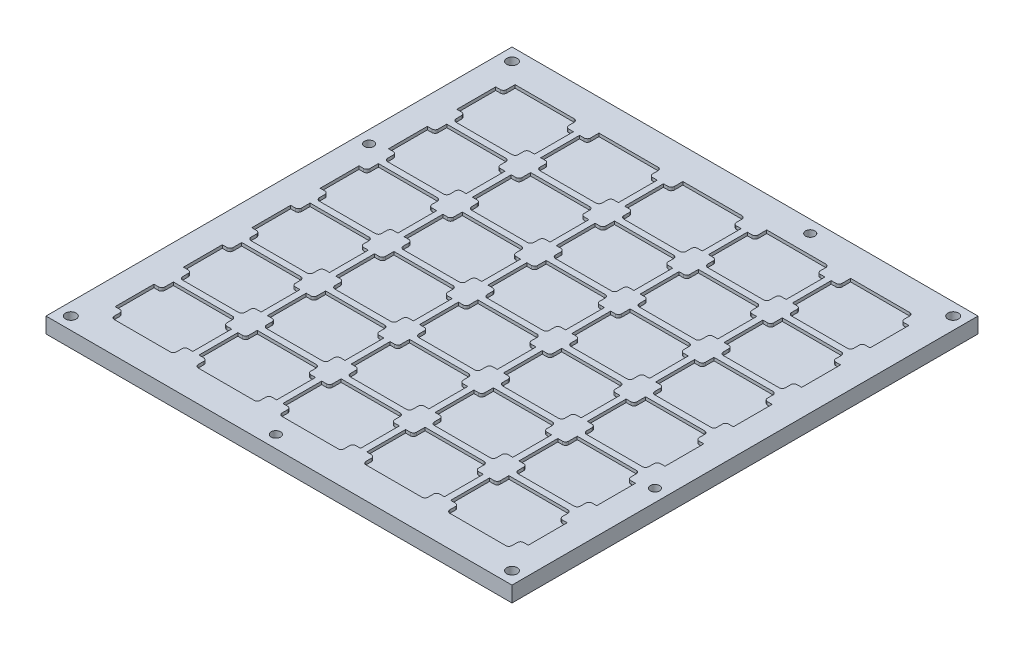
from build123d import *

# Parameters (mm, degrees)
SKETCH1_W                                       = 150
SKETCH1_H                                       = 150
BOSS_EXTRUDE1_DEPTH                             = 5
SKETCH2_W                                       = 20
SKETCH2_H                                       = 20
SKETCH2_W_2                                     = 2.5
SKETCH2_H_2                                     = 12.5
CUT_EXTRUDE1_DEPTH                              = 1
FILLET1_R                                       = 1
LPATTERN1_START                                 = 4
LPATTERN1_DEPTH                                 = 1
CSK_FOR_M3_FLAT_HEAD_MACHINE_SCREW1_D           = 3.4
CSK_FOR_M3_FLAT_HEAD_MACHINE_SCREW1_DEPTH       = 17.07
CSK_FOR_M3_FLAT_HEAD_MACHINE_SCREW1_CSINK_D     = 6.3
CSK_FOR_M3_FLAT_HEAD_MACHINE_SCREW1_CSINK_ANGLE = 90
CSK_FOR_M3_FLAT_HEAD_MACHINE_SCREW1_TIP         = 1.021463052
CSK_FOR_M3_FLAT_HEAD_MACHINE_SCREW2_D           = 3
CSK_FOR_M3_FLAT_HEAD_MACHINE_SCREW2_CSINK_D     = 6
CSK_FOR_M3_FLAT_HEAD_MACHINE_SCREW2_CSINK_ANGLE = 150


# Read off the part's stored shape, not the designer's step: LPattern1
with BuildPart() as part:
    # Sketch1 → Boss-Extrude1 (new body)
    with BuildSketch(Plane(origin=(0, 0, 0), x_dir=(1, 0, 0), z_dir=(0, 1, 0))):
        with Locations((73.607910906, -74.514208909)):
            Rectangle(SKETCH1_W, SKETCH1_H)
    extrude(amount=BOSS_EXTRUDE1_DEPTH)

    # Sketch2 → Cut-Extrude1 (cut)
    with BuildSketch(Plane(origin=(0, 5, 0), x_dir=(1, 0, 0), z_dir=(0, 1, 0))):
        with Locations((19.607910906, -19.514208909)):
            Rectangle(SKETCH2_W, SKETCH2_H)
        with Locations((8.357910906, -19.514208909)):
            Rectangle(SKETCH2_W_2, SKETCH2_H_2)
        with Locations((30.857910906, -19.514208909)):
            Rectangle(SKETCH2_W_2, SKETCH2_H_2)
    extrude(amount=-CUT_EXTRUDE1_DEPTH, mode=Mode.SUBTRACT)

    # Fillet1
    fillet1_edges = [part.edges().sort_by_distance(p)[0] for p in [
        (9.607910906, 4.5, 13.264208909),
        (9.607910906, 4.5, 25.764208909),
        (9.607910906, 4.5, 29.514208909),
        (29.607910906, 4.5, 29.514208909),
        (29.607910906, 4.5, 25.764208909),
        (29.607910906, 4.5, 13.264208909),
        (29.607910906, 4.5, 9.514208909),
    ]]
    fillet(fillet1_edges, radius=FILLET1_R)

    # LPattern1 outline → LPattern1 (cut)
    with BuildSketch(Plane(origin=(0, 0, 0), x_dir=(1, 0, 0), z_dir=(0, 1, 0)).offset(LPATTERN1_START)):
        with BuildLine():
            ThreePointArc((117.607910906, -122.264208909), (117.315017687, -122.971315691), (116.607910906, -123.264208909))
            Line((116.607910906, -123.264208909), (115.107910906, -123.264208909))
            Line((115.107910906, -123.264208909), (115.107910906, -135.764208909))
            Line((115.107910906, -135.764208909), (116.607910906, -135.764208909))
            ThreePointArc((116.607910906, -135.764208909), (117.315017687, -136.057102128), (117.607910906, -136.764208909))
            Line((117.607910906, -136.764208909), (117.607910906, -138.514208909))
            ThreePointArc((117.607910906, -138.514208909), (117.900804124, -139.221315691), (118.607910906, -139.514208909))
            Line((118.607910906, -139.514208909), (136.607910906, -139.514208909))
            ThreePointArc((136.607910906, -139.514208909), (137.315017687, -139.22131569), (137.607910906, -138.514208909))
            Line((137.607910906, -138.514208909), (137.607910906, -136.764208909))
            ThreePointArc((137.607910906, -136.764208909), (137.900804125, -136.057102128), (138.607910906, -135.764208909))
            Line((138.607910906, -135.764208909), (140.107910906, -135.764208909))
            Line((140.107910906, -135.764208909), (140.107910906, -123.264208909))
            Line((140.107910906, -123.264208909), (138.607910906, -123.264208909))
            ThreePointArc((138.607910906, -123.264208909), (137.900804125, -122.971315691), (137.607910906, -122.264208909))
            Line((137.607910906, -122.264208909), (137.607910906, -120.514208909))
            ThreePointArc((137.607910906, -120.514208909), (137.315017687, -119.807102128), (136.607910906, -119.514208909))
            Line((136.607910906, -119.514208909), (117.607910906, -119.514208909))
            Line((117.607910906, -119.514208909), (117.607910906, -122.264208909))
        make_face()
        with BuildLine():
            Line((137.607910906, -100.264208909), (137.607910906, -98.514208909))
            ThreePointArc((137.607910906, -98.514208909), (137.315017687, -97.807102128), (136.607910906, -97.514208909))
            Line((136.607910906, -97.514208909), (117.607910906, -97.514208909))
            Line((117.607910906, -97.514208909), (117.607910906, -100.264208909))
            ThreePointArc((117.607910906, -100.264208909), (117.315017687, -100.971315691), (116.607910906, -101.264208909))
            Line((116.607910906, -101.264208909), (115.107910906, -101.264208909))
            Line((115.107910906, -101.264208909), (115.107910906, -113.764208909))
            Line((115.107910906, -113.764208909), (116.607910906, -113.764208909))
            ThreePointArc((116.607910906, -113.764208909), (117.315017687, -114.057102128), (117.607910906, -114.764208909))
            Line((117.607910906, -114.764208909), (117.607910906, -116.514208909))
            ThreePointArc((117.607910906, -116.514208909), (117.900804124, -117.221315691), (118.607910906, -117.514208909))
            Line((118.607910906, -117.514208909), (136.607910906, -117.514208909))
            ThreePointArc((136.607910906, -117.514208909), (137.315017687, -117.221315691), (137.607910906, -116.514208909))
            Line((137.607910906, -116.514208909), (137.607910906, -114.764208909))
            ThreePointArc((137.607910906, -114.764208909), (137.900804125, -114.057102128), (138.607910906, -113.764208909))
            Line((138.607910906, -113.764208909), (140.107910906, -113.764208909))
            Line((140.107910906, -113.764208909), (140.107910906, -101.264208909))
            Line((140.107910906, -101.264208909), (138.607910906, -101.264208909))
            ThreePointArc((138.607910906, -101.264208909), (137.900804125, -100.971315691), (137.607910906, -100.264208909))
        make_face()
        with BuildLine():
            Line((137.607910906, -78.264208909), (137.607910906, -76.514208909))
            ThreePointArc((137.607910906, -76.514208909), (137.315017687, -75.807102128), (136.607910906, -75.514208909))
            Line((136.607910906, -75.514208909), (117.607910906, -75.514208909))
            Line((117.607910906, -75.514208909), (117.607910906, -78.264208909))
            ThreePointArc((117.607910906, -78.264208909), (117.315017687, -78.971315691), (116.607910906, -79.264208909))
            Line((116.607910906, -79.264208909), (115.107910906, -79.264208909))
            Line((115.107910906, -79.264208909), (115.107910906, -91.764208909))
            Line((115.107910906, -91.764208909), (116.607910906, -91.764208909))
            ThreePointArc((116.607910906, -91.764208909), (117.315017687, -92.057102128), (117.607910906, -92.764208909))
            Line((117.607910906, -92.764208909), (117.607910906, -94.514208909))
            ThreePointArc((117.607910906, -94.514208909), (117.900804124, -95.221315691), (118.607910906, -95.514208909))
            Line((118.607910906, -95.514208909), (136.607910906, -95.514208909))
            ThreePointArc((136.607910906, -95.514208909), (137.315017687, -95.221315691), (137.607910906, -94.514208909))
            Line((137.607910906, -94.514208909), (137.607910906, -92.764208909))
            ThreePointArc((137.607910906, -92.764208909), (137.900804125, -92.057102128), (138.607910906, -91.764208909))
            Line((138.607910906, -91.764208909), (140.107910906, -91.764208909))
            Line((140.107910906, -91.764208909), (140.107910906, -79.264208909))
            Line((140.107910906, -79.264208909), (138.607910906, -79.264208909))
            ThreePointArc((138.607910906, -79.264208909), (137.900804125, -78.971315691), (137.607910906, -78.264208909))
        make_face()
        with BuildLine():
            Line((137.607910906, -56.264208909), (137.607910906, -54.514208909))
            ThreePointArc((137.607910906, -54.514208909), (137.315017687, -53.807102128), (136.607910906, -53.514208909))
            Line((136.607910906, -53.514208909), (117.607910906, -53.514208909))
            Line((117.607910906, -53.514208909), (117.607910906, -56.264208909))
            ThreePointArc((117.607910906, -56.264208909), (117.315017688, -56.97131569), (116.607910906, -57.264208909))
            Line((116.607910906, -57.264208909), (115.107910906, -57.264208909))
            Line((115.107910906, -57.264208909), (115.107910906, -69.764208909))
            Line((115.107910906, -69.764208909), (116.607910906, -69.764208909))
            ThreePointArc((116.607910906, -69.764208909), (117.315017687, -70.057102128), (117.607910906, -70.764208909))
            Line((117.607910906, -70.764208909), (117.607910906, -72.514208909))
            ThreePointArc((117.607910906, -72.514208909), (117.900804124, -73.221315691), (118.607910906, -73.514208909))
            Line((118.607910906, -73.514208909), (136.607910906, -73.514208909))
            ThreePointArc((136.607910906, -73.514208909), (137.315017687, -73.221315691), (137.607910906, -72.514208909))
            Line((137.607910906, -72.514208909), (137.607910906, -70.764208909))
            ThreePointArc((137.607910906, -70.764208909), (137.900804125, -70.057102128), (138.607910906, -69.764208909))
            Line((138.607910906, -69.764208909), (140.107910906, -69.764208909))
            Line((140.107910906, -69.764208909), (140.107910906, -57.264208909))
            Line((140.107910906, -57.264208909), (138.607910906, -57.264208909))
            ThreePointArc((138.607910906, -57.264208909), (137.900804125, -56.97131569), (137.607910906, -56.264208909))
        make_face()
        with BuildLine():
            Line((137.607910906, -34.264208909), (137.607910906, -32.514208909))
            ThreePointArc((137.607910906, -32.514208909), (137.315017687, -31.807102128), (136.607910906, -31.514208909))
            Line((136.607910906, -31.514208909), (117.607910906, -31.514208909))
            Line((117.607910906, -31.514208909), (117.607910906, -34.264208909))
            ThreePointArc((117.607910906, -34.264208909), (117.315017688, -34.97131569), (116.607910906, -35.264208909))
            Line((116.607910906, -35.264208909), (115.107910906, -35.264208909))
            Line((115.107910906, -35.264208909), (115.107910906, -47.764208909))
            Line((115.107910906, -47.764208909), (116.607910906, -47.764208909))
            ThreePointArc((116.607910906, -47.764208909), (117.315017687, -48.057102128), (117.607910906, -48.764208909))
            Line((117.607910906, -48.764208909), (117.607910906, -50.514208909))
            ThreePointArc((117.607910906, -50.514208909), (117.900804124, -51.221315691), (118.607910906, -51.514208909))
            Line((118.607910906, -51.514208909), (136.607910906, -51.514208909))
            ThreePointArc((136.607910906, -51.514208909), (137.315017687, -51.22131569), (137.607910906, -50.514208909))
            Line((137.607910906, -50.514208909), (137.607910906, -48.764208909))
            ThreePointArc((137.607910906, -48.764208909), (137.900804125, -48.057102128), (138.607910906, -47.764208909))
            Line((138.607910906, -47.764208909), (140.107910906, -47.764208909))
            Line((140.107910906, -47.764208909), (140.107910906, -35.264208909))
            Line((140.107910906, -35.264208909), (138.607910906, -35.264208909))
            ThreePointArc((138.607910906, -35.264208909), (137.900804125, -34.97131569), (137.607910906, -34.264208909))
        make_face()
        with BuildLine():
            Line((137.607910906, -12.264208909), (137.607910906, -10.514208909))
            ThreePointArc((137.607910906, -10.514208909), (137.315017687, -9.807102128), (136.607910906, -9.514208909))
            Line((136.607910906, -9.514208909), (117.607910906, -9.514208909))
            Line((117.607910906, -9.514208909), (117.607910906, -12.264208909))
            ThreePointArc((117.607910906, -12.264208909), (117.315017688, -12.97131569), (116.607910906, -13.264208909))
            Line((116.607910906, -13.264208909), (115.107910906, -13.264208909))
            Line((115.107910906, -13.264208909), (115.107910906, -25.764208909))
            Line((115.107910906, -25.764208909), (116.607910906, -25.764208909))
            ThreePointArc((116.607910906, -25.764208909), (117.315017687, -26.057102128), (117.607910906, -26.764208909))
            Line((117.607910906, -26.764208909), (117.607910906, -28.514208909))
            ThreePointArc((117.607910906, -28.514208909), (117.900804124, -29.221315691), (118.607910906, -29.514208909))
            Line((118.607910906, -29.514208909), (136.607910906, -29.514208909))
            ThreePointArc((136.607910906, -29.514208909), (137.315017687, -29.22131569), (137.607910906, -28.514208909))
            Line((137.607910906, -28.514208909), (137.607910906, -26.764208909))
            ThreePointArc((137.607910906, -26.764208909), (137.900804125, -26.057102128), (138.607910906, -25.764208909))
            Line((138.607910906, -25.764208909), (140.107910906, -25.764208909))
            Line((140.107910906, -25.764208909), (140.107910906, -13.264208909))
            Line((140.107910906, -13.264208909), (138.607910906, -13.264208909))
            ThreePointArc((138.607910906, -13.264208909), (137.900804125, -12.97131569), (137.607910906, -12.264208909))
        make_face()
        with BuildLine():
            Line((109.607910906, -119.514208909), (90.607910906, -119.514208909))
            Line((90.607910906, -119.514208909), (90.607910906, -122.264208909))
            ThreePointArc((90.607910906, -122.264208909), (90.315017687, -122.971315691), (89.607910906, -123.264208909))
            Line((89.607910906, -123.264208909), (88.107910906, -123.264208909))
            Line((88.107910906, -123.264208909), (88.107910906, -135.764208909))
            Line((88.107910906, -135.764208909), (89.607910906, -135.764208909))
            ThreePointArc((89.607910906, -135.764208909), (90.315017687, -136.057102128), (90.607910906, -136.764208909))
            Line((90.607910906, -136.764208909), (90.607910906, -138.514208909))
            ThreePointArc((90.607910906, -138.514208909), (90.900804124, -139.221315691), (91.607910906, -139.514208909))
            Line((91.607910906, -139.514208909), (109.607910906, -139.514208909))
            ThreePointArc((109.607910906, -139.514208909), (110.315017688, -139.22131569), (110.607910906, -138.514208909))
            Line((110.607910906, -138.514208909), (110.607910906, -136.764208909))
            ThreePointArc((110.607910906, -136.764208909), (110.900804125, -136.057102128), (111.607910906, -135.764208909))
            Line((111.607910906, -135.764208909), (113.107910906, -135.764208909))
            Line((113.107910906, -135.764208909), (113.107910906, -123.264208909))
            Line((113.107910906, -123.264208909), (111.607910906, -123.264208909))
            ThreePointArc((111.607910906, -123.264208909), (110.900804124, -122.971315691), (110.607910906, -122.264208909))
            Line((110.607910906, -122.264208909), (110.607910906, -120.514208909))
            ThreePointArc((110.607910906, -120.514208909), (110.315017687, -119.807102128), (109.607910906, -119.514208909))
        make_face()
        with BuildLine():
            Line((82.607910906, -119.514208909), (63.607910906, -119.514208909))
            Line((63.607910906, -119.514208909), (63.607910906, -122.264208909))
            ThreePointArc((63.607910906, -122.264208909), (63.315017687, -122.971315691), (62.607910906, -123.264208909))
            Line((62.607910906, -123.264208909), (61.107910906, -123.264208909))
            Line((61.107910906, -123.264208909), (61.107910906, -135.764208909))
            Line((61.107910906, -135.764208909), (62.607910906, -135.764208909))
            ThreePointArc((62.607910906, -135.764208909), (63.315017687, -136.057102128), (63.607910906, -136.764208909))
            Line((63.607910906, -136.764208909), (63.607910906, -138.514208909))
            ThreePointArc((63.607910906, -138.514208909), (63.900804124, -139.22131569), (64.607910906, -139.514208909))
            Line((64.607910906, -139.514208909), (82.607910906, -139.514208909))
            ThreePointArc((82.607910906, -139.514208909), (83.315017688, -139.22131569), (83.607910906, -138.514208909))
            Line((83.607910906, -138.514208909), (83.607910906, -136.764208909))
            ThreePointArc((83.607910906, -136.764208909), (83.900804125, -136.057102128), (84.607910906, -135.764208909))
            Line((84.607910906, -135.764208909), (86.107910906, -135.764208909))
            Line((86.107910906, -135.764208909), (86.107910906, -123.264208909))
            Line((86.107910906, -123.264208909), (84.607910906, -123.264208909))
            ThreePointArc((84.607910906, -123.264208909), (83.900804124, -122.971315691), (83.607910906, -122.264208909))
            Line((83.607910906, -122.264208909), (83.607910906, -120.514208909))
            ThreePointArc((83.607910906, -120.514208909), (83.315017687, -119.807102128), (82.607910906, -119.514208909))
        make_face()
        with BuildLine():
            Line((55.607910906, -119.514208909), (36.607910906, -119.514208909))
            Line((36.607910906, -119.514208909), (36.607910906, -122.264208909))
            ThreePointArc((36.607910906, -122.264208909), (36.315017687, -122.971315691), (35.607910906, -123.264208909))
            Line((35.607910906, -123.264208909), (34.107910906, -123.264208909))
            Line((34.107910906, -123.264208909), (34.107910906, -135.764208909))
            Line((34.107910906, -135.764208909), (35.607910906, -135.764208909))
            ThreePointArc((35.607910906, -135.764208909), (36.315017687, -136.057102128), (36.607910906, -136.764208909))
            Line((36.607910906, -136.764208909), (36.607910906, -138.514208909))
            ThreePointArc((36.607910906, -138.514208909), (36.900804124, -139.22131569), (37.607910906, -139.514208909))
            Line((37.607910906, -139.514208909), (55.607910906, -139.514208909))
            ThreePointArc((55.607910906, -139.514208909), (56.315017688, -139.22131569), (56.607910906, -138.514208909))
            Line((56.607910906, -138.514208909), (56.607910906, -136.764208909))
            ThreePointArc((56.607910906, -136.764208909), (56.900804125, -136.057102128), (57.607910906, -135.764208909))
            Line((57.607910906, -135.764208909), (59.107910906, -135.764208909))
            Line((59.107910906, -135.764208909), (59.107910906, -123.264208909))
            Line((59.107910906, -123.264208909), (57.607910906, -123.264208909))
            ThreePointArc((57.607910906, -123.264208909), (56.900804125, -122.971315691), (56.607910906, -122.264208909))
            Line((56.607910906, -122.264208909), (56.607910906, -120.514208909))
            ThreePointArc((56.607910906, -120.514208909), (56.315017687, -119.807102128), (55.607910906, -119.514208909))
        make_face()
        with BuildLine():
            Line((28.607910906, -119.514208909), (9.607910906, -119.514208909))
            Line((9.607910906, -119.514208909), (9.607910906, -122.264208909))
            ThreePointArc((9.607910906, -122.264208909), (9.315017687, -122.971315691), (8.607910906, -123.264208909))
            Line((8.607910906, -123.264208909), (7.107910906, -123.264208909))
            Line((7.107910906, -123.264208909), (7.107910906, -135.764208909))
            Line((7.107910906, -135.764208909), (8.607910906, -135.764208909))
            ThreePointArc((8.607910906, -135.764208909), (9.315017687, -136.057102128), (9.607910906, -136.764208909))
            Line((9.607910906, -136.764208909), (9.607910906, -138.514208909))
            ThreePointArc((9.607910906, -138.514208909), (9.900804124, -139.22131569), (10.607910906, -139.514208909))
            Line((10.607910906, -139.514208909), (28.607910906, -139.514208909))
            ThreePointArc((28.607910906, -139.514208909), (29.315017688, -139.22131569), (29.607910906, -138.514208909))
            Line((29.607910906, -138.514208909), (29.607910906, -136.764208909))
            ThreePointArc((29.607910906, -136.764208909), (29.900804125, -136.057102128), (30.607910906, -135.764208909))
            Line((30.607910906, -135.764208909), (32.107910906, -135.764208909))
            Line((32.107910906, -135.764208909), (32.107910906, -123.264208909))
            Line((32.107910906, -123.264208909), (30.607910906, -123.264208909))
            ThreePointArc((30.607910906, -123.264208909), (29.900804125, -122.971315691), (29.607910906, -122.264208909))
            Line((29.607910906, -122.264208909), (29.607910906, -120.514208909))
            ThreePointArc((29.607910906, -120.514208909), (29.315017687, -119.807102128), (28.607910906, -119.514208909))
        make_face()
        with BuildLine():
            Line((110.607910906, -100.264208909), (110.607910906, -98.514208909))
            ThreePointArc((110.607910906, -98.514208909), (110.315017687, -97.807102128), (109.607910906, -97.514208909))
            Line((109.607910906, -97.514208909), (90.607910906, -97.514208909))
            Line((90.607910906, -97.514208909), (90.607910906, -100.264208909))
            ThreePointArc((90.607910906, -100.264208909), (90.315017687, -100.971315691), (89.607910906, -101.264208909))
            Line((89.607910906, -101.264208909), (88.107910906, -101.264208909))
            Line((88.107910906, -101.264208909), (88.107910906, -113.764208909))
            Line((88.107910906, -113.764208909), (89.607910906, -113.764208909))
            ThreePointArc((89.607910906, -113.764208909), (90.315017687, -114.057102128), (90.607910906, -114.764208909))
            Line((90.607910906, -114.764208909), (90.607910906, -116.514208909))
            ThreePointArc((90.607910906, -116.514208909), (90.900804124, -117.221315691), (91.607910906, -117.514208909))
            Line((91.607910906, -117.514208909), (109.607910906, -117.514208909))
            ThreePointArc((109.607910906, -117.514208909), (110.315017687, -117.221315691), (110.607910906, -116.514208909))
            Line((110.607910906, -116.514208909), (110.607910906, -114.764208909))
            ThreePointArc((110.607910906, -114.764208909), (110.900804125, -114.057102128), (111.607910906, -113.764208909))
            Line((111.607910906, -113.764208909), (113.107910906, -113.764208909))
            Line((113.107910906, -113.764208909), (113.107910906, -101.264208909))
            Line((113.107910906, -101.264208909), (111.607910906, -101.264208909))
            ThreePointArc((111.607910906, -101.264208909), (110.900804124, -100.971315691), (110.607910906, -100.264208909))
        make_face()
        with BuildLine():
            Line((110.607910906, -78.264208909), (110.607910906, -76.514208909))
            ThreePointArc((110.607910906, -76.514208909), (110.315017687, -75.807102128), (109.607910906, -75.514208909))
            Line((109.607910906, -75.514208909), (90.607910906, -75.514208909))
            Line((90.607910906, -75.514208909), (90.607910906, -78.264208909))
            ThreePointArc((90.607910906, -78.264208909), (90.315017687, -78.971315691), (89.607910906, -79.264208909))
            Line((89.607910906, -79.264208909), (88.107910906, -79.264208909))
            Line((88.107910906, -79.264208909), (88.107910906, -91.764208909))
            Line((88.107910906, -91.764208909), (89.607910906, -91.764208909))
            ThreePointArc((89.607910906, -91.764208909), (90.315017687, -92.057102128), (90.607910906, -92.764208909))
            Line((90.607910906, -92.764208909), (90.607910906, -94.514208909))
            ThreePointArc((90.607910906, -94.514208909), (90.900804124, -95.221315691), (91.607910906, -95.514208909))
            Line((91.607910906, -95.514208909), (109.607910906, -95.514208909))
            ThreePointArc((109.607910906, -95.514208909), (110.315017687, -95.221315691), (110.607910906, -94.514208909))
            Line((110.607910906, -94.514208909), (110.607910906, -92.764208909))
            ThreePointArc((110.607910906, -92.764208909), (110.900804125, -92.057102128), (111.607910906, -91.764208909))
            Line((111.607910906, -91.764208909), (113.107910906, -91.764208909))
            Line((113.107910906, -91.764208909), (113.107910906, -79.264208909))
            Line((113.107910906, -79.264208909), (111.607910906, -79.264208909))
            ThreePointArc((111.607910906, -79.264208909), (110.900804124, -78.971315691), (110.607910906, -78.264208909))
        make_face()
        with BuildLine():
            Line((110.607910906, -56.264208909), (110.607910906, -54.514208909))
            ThreePointArc((110.607910906, -54.514208909), (110.315017687, -53.807102128), (109.607910906, -53.514208909))
            Line((109.607910906, -53.514208909), (90.607910906, -53.514208909))
            Line((90.607910906, -53.514208909), (90.607910906, -56.264208909))
            ThreePointArc((90.607910906, -56.264208909), (90.315017688, -56.97131569), (89.607910906, -57.264208909))
            Line((89.607910906, -57.264208909), (88.107910906, -57.264208909))
            Line((88.107910906, -57.264208909), (88.107910906, -69.764208909))
            Line((88.107910906, -69.764208909), (89.607910906, -69.764208909))
            ThreePointArc((89.607910906, -69.764208909), (90.315017687, -70.057102128), (90.607910906, -70.764208909))
            Line((90.607910906, -70.764208909), (90.607910906, -72.514208909))
            ThreePointArc((90.607910906, -72.514208909), (90.900804124, -73.221315691), (91.607910906, -73.514208909))
            Line((91.607910906, -73.514208909), (109.607910906, -73.514208909))
            ThreePointArc((109.607910906, -73.514208909), (110.315017687, -73.221315691), (110.607910906, -72.514208909))
            Line((110.607910906, -72.514208909), (110.607910906, -70.764208909))
            ThreePointArc((110.607910906, -70.764208909), (110.900804125, -70.057102128), (111.607910906, -69.764208909))
            Line((111.607910906, -69.764208909), (113.107910906, -69.764208909))
            Line((113.107910906, -69.764208909), (113.107910906, -57.264208909))
            Line((113.107910906, -57.264208909), (111.607910906, -57.264208909))
            ThreePointArc((111.607910906, -57.264208909), (110.900804124, -56.971315691), (110.607910906, -56.264208909))
        make_face()
        with BuildLine():
            Line((110.607910906, -34.264208909), (110.607910906, -32.514208909))
            ThreePointArc((110.607910906, -32.514208909), (110.315017687, -31.807102128), (109.607910906, -31.514208909))
            Line((109.607910906, -31.514208909), (90.607910906, -31.514208909))
            Line((90.607910906, -31.514208909), (90.607910906, -34.264208909))
            ThreePointArc((90.607910906, -34.264208909), (90.315017688, -34.97131569), (89.607910906, -35.264208909))
            Line((89.607910906, -35.264208909), (88.107910906, -35.264208909))
            Line((88.107910906, -35.264208909), (88.107910906, -47.764208909))
            Line((88.107910906, -47.764208909), (89.607910906, -47.764208909))
            ThreePointArc((89.607910906, -47.764208909), (90.315017687, -48.057102128), (90.607910906, -48.764208909))
            Line((90.607910906, -48.764208909), (90.607910906, -50.514208909))
            ThreePointArc((90.607910906, -50.514208909), (90.900804124, -51.221315691), (91.607910906, -51.514208909))
            Line((91.607910906, -51.514208909), (109.607910906, -51.514208909))
            ThreePointArc((109.607910906, -51.514208909), (110.315017688, -51.22131569), (110.607910906, -50.514208909))
            Line((110.607910906, -50.514208909), (110.607910906, -48.764208909))
            ThreePointArc((110.607910906, -48.764208909), (110.900804125, -48.057102128), (111.607910906, -47.764208909))
            Line((111.607910906, -47.764208909), (113.107910906, -47.764208909))
            Line((113.107910906, -47.764208909), (113.107910906, -35.264208909))
            Line((113.107910906, -35.264208909), (111.607910906, -35.264208909))
            ThreePointArc((111.607910906, -35.264208909), (110.900804124, -34.971315691), (110.607910906, -34.264208909))
        make_face()
        with BuildLine():
            Line((110.607910906, -12.264208909), (110.607910906, -10.514208909))
            ThreePointArc((110.607910906, -10.514208909), (110.315017687, -9.807102128), (109.607910906, -9.514208909))
            Line((109.607910906, -9.514208909), (90.607910906, -9.514208909))
            Line((90.607910906, -9.514208909), (90.607910906, -12.264208909))
            ThreePointArc((90.607910906, -12.264208909), (90.315017688, -12.97131569), (89.607910906, -13.264208909))
            Line((89.607910906, -13.264208909), (88.107910906, -13.264208909))
            Line((88.107910906, -13.264208909), (88.107910906, -25.764208909))
            Line((88.107910906, -25.764208909), (89.607910906, -25.764208909))
            ThreePointArc((89.607910906, -25.764208909), (90.315017687, -26.057102128), (90.607910906, -26.764208909))
            Line((90.607910906, -26.764208909), (90.607910906, -28.514208909))
            ThreePointArc((90.607910906, -28.514208909), (90.900804124, -29.221315691), (91.607910906, -29.514208909))
            Line((91.607910906, -29.514208909), (109.607910906, -29.514208909))
            ThreePointArc((109.607910906, -29.514208909), (110.315017688, -29.22131569), (110.607910906, -28.514208909))
            Line((110.607910906, -28.514208909), (110.607910906, -26.764208909))
            ThreePointArc((110.607910906, -26.764208909), (110.900804125, -26.057102128), (111.607910906, -25.764208909))
            Line((111.607910906, -25.764208909), (113.107910906, -25.764208909))
            Line((113.107910906, -25.764208909), (113.107910906, -13.264208909))
            Line((113.107910906, -13.264208909), (111.607910906, -13.264208909))
            ThreePointArc((111.607910906, -13.264208909), (110.900804124, -12.971315691), (110.607910906, -12.264208909))
        make_face()
        with BuildLine():
            Line((83.607910906, -100.264208909), (83.607910906, -98.514208909))
            ThreePointArc((83.607910906, -98.514208909), (83.315017687, -97.807102128), (82.607910906, -97.514208909))
            Line((82.607910906, -97.514208909), (63.607910906, -97.514208909))
            Line((63.607910906, -97.514208909), (63.607910906, -100.264208909))
            ThreePointArc((63.607910906, -100.264208909), (63.315017687, -100.971315691), (62.607910906, -101.264208909))
            Line((62.607910906, -101.264208909), (61.107910906, -101.264208909))
            Line((61.107910906, -101.264208909), (61.107910906, -113.764208909))
            Line((61.107910906, -113.764208909), (62.607910906, -113.764208909))
            ThreePointArc((62.607910906, -113.764208909), (63.315017687, -114.057102128), (63.607910906, -114.764208909))
            Line((63.607910906, -114.764208909), (63.607910906, -116.514208909))
            ThreePointArc((63.607910906, -116.514208909), (63.900804124, -117.221315691), (64.607910906, -117.514208909))
            Line((64.607910906, -117.514208909), (82.607910906, -117.514208909))
            ThreePointArc((82.607910906, -117.514208909), (83.315017687, -117.221315691), (83.607910906, -116.514208909))
            Line((83.607910906, -116.514208909), (83.607910906, -114.764208909))
            ThreePointArc((83.607910906, -114.764208909), (83.900804125, -114.057102128), (84.607910906, -113.764208909))
            Line((84.607910906, -113.764208909), (86.107910906, -113.764208909))
            Line((86.107910906, -113.764208909), (86.107910906, -101.264208909))
            Line((86.107910906, -101.264208909), (84.607910906, -101.264208909))
            ThreePointArc((84.607910906, -101.264208909), (83.900804124, -100.971315691), (83.607910906, -100.264208909))
        make_face()
        with BuildLine():
            Line((83.607910906, -78.264208909), (83.607910906, -76.514208909))
            ThreePointArc((83.607910906, -76.514208909), (83.315017687, -75.807102128), (82.607910906, -75.514208909))
            Line((82.607910906, -75.514208909), (63.607910906, -75.514208909))
            Line((63.607910906, -75.514208909), (63.607910906, -78.264208909))
            ThreePointArc((63.607910906, -78.264208909), (63.315017687, -78.971315691), (62.607910906, -79.264208909))
            Line((62.607910906, -79.264208909), (61.107910906, -79.264208909))
            Line((61.107910906, -79.264208909), (61.107910906, -91.764208909))
            Line((61.107910906, -91.764208909), (62.607910906, -91.764208909))
            ThreePointArc((62.607910906, -91.764208909), (63.315017687, -92.057102128), (63.607910906, -92.764208909))
            Line((63.607910906, -92.764208909), (63.607910906, -94.514208909))
            ThreePointArc((63.607910906, -94.514208909), (63.900804124, -95.221315691), (64.607910906, -95.514208909))
            Line((64.607910906, -95.514208909), (82.607910906, -95.514208909))
            ThreePointArc((82.607910906, -95.514208909), (83.315017687, -95.221315691), (83.607910906, -94.514208909))
            Line((83.607910906, -94.514208909), (83.607910906, -92.764208909))
            ThreePointArc((83.607910906, -92.764208909), (83.900804125, -92.057102128), (84.607910906, -91.764208909))
            Line((84.607910906, -91.764208909), (86.107910906, -91.764208909))
            Line((86.107910906, -91.764208909), (86.107910906, -79.264208909))
            Line((86.107910906, -79.264208909), (84.607910906, -79.264208909))
            ThreePointArc((84.607910906, -79.264208909), (83.900804124, -78.971315691), (83.607910906, -78.264208909))
        make_face()
        with BuildLine():
            Line((83.607910906, -56.264208909), (83.607910906, -54.514208909))
            ThreePointArc((83.607910906, -54.514208909), (83.315017687, -53.807102128), (82.607910906, -53.514208909))
            Line((82.607910906, -53.514208909), (63.607910906, -53.514208909))
            Line((63.607910906, -53.514208909), (63.607910906, -56.264208909))
            ThreePointArc((63.607910906, -56.264208909), (63.315017688, -56.97131569), (62.607910906, -57.264208909))
            Line((62.607910906, -57.264208909), (61.107910906, -57.264208909))
            Line((61.107910906, -57.264208909), (61.107910906, -69.764208909))
            Line((61.107910906, -69.764208909), (62.607910906, -69.764208909))
            ThreePointArc((62.607910906, -69.764208909), (63.315017687, -70.057102128), (63.607910906, -70.764208909))
            Line((63.607910906, -70.764208909), (63.607910906, -72.514208909))
            ThreePointArc((63.607910906, -72.514208909), (63.900804124, -73.221315691), (64.607910906, -73.514208909))
            Line((64.607910906, -73.514208909), (82.607910906, -73.514208909))
            ThreePointArc((82.607910906, -73.514208909), (83.315017687, -73.221315691), (83.607910906, -72.514208909))
            Line((83.607910906, -72.514208909), (83.607910906, -70.764208909))
            ThreePointArc((83.607910906, -70.764208909), (83.900804125, -70.057102128), (84.607910906, -69.764208909))
            Line((84.607910906, -69.764208909), (86.107910906, -69.764208909))
            Line((86.107910906, -69.764208909), (86.107910906, -57.264208909))
            Line((86.107910906, -57.264208909), (84.607910906, -57.264208909))
            ThreePointArc((84.607910906, -57.264208909), (83.900804124, -56.971315691), (83.607910906, -56.264208909))
        make_face()
        with BuildLine():
            Line((83.607910906, -34.264208909), (83.607910906, -32.514208909))
            ThreePointArc((83.607910906, -32.514208909), (83.315017687, -31.807102128), (82.607910906, -31.514208909))
            Line((82.607910906, -31.514208909), (63.607910906, -31.514208909))
            Line((63.607910906, -31.514208909), (63.607910906, -34.264208909))
            ThreePointArc((63.607910906, -34.264208909), (63.315017688, -34.97131569), (62.607910906, -35.264208909))
            Line((62.607910906, -35.264208909), (61.107910906, -35.264208909))
            Line((61.107910906, -35.264208909), (61.107910906, -47.764208909))
            Line((61.107910906, -47.764208909), (62.607910906, -47.764208909))
            ThreePointArc((62.607910906, -47.764208909), (63.315017687, -48.057102128), (63.607910906, -48.764208909))
            Line((63.607910906, -48.764208909), (63.607910906, -50.514208909))
            ThreePointArc((63.607910906, -50.514208909), (63.900804124, -51.22131569), (64.607910906, -51.514208909))
            Line((64.607910906, -51.514208909), (82.607910906, -51.514208909))
            ThreePointArc((82.607910906, -51.514208909), (83.315017688, -51.22131569), (83.607910906, -50.514208909))
            Line((83.607910906, -50.514208909), (83.607910906, -48.764208909))
            ThreePointArc((83.607910906, -48.764208909), (83.900804125, -48.057102128), (84.607910906, -47.764208909))
            Line((84.607910906, -47.764208909), (86.107910906, -47.764208909))
            Line((86.107910906, -47.764208909), (86.107910906, -35.264208909))
            Line((86.107910906, -35.264208909), (84.607910906, -35.264208909))
            ThreePointArc((84.607910906, -35.264208909), (83.900804124, -34.971315691), (83.607910906, -34.264208909))
        make_face()
        with BuildLine():
            Line((83.607910906, -12.264208909), (83.607910906, -10.514208909))
            ThreePointArc((83.607910906, -10.514208909), (83.315017687, -9.807102128), (82.607910906, -9.514208909))
            Line((82.607910906, -9.514208909), (63.607910906, -9.514208909))
            Line((63.607910906, -9.514208909), (63.607910906, -12.264208909))
            ThreePointArc((63.607910906, -12.264208909), (63.315017688, -12.97131569), (62.607910906, -13.264208909))
            Line((62.607910906, -13.264208909), (61.107910906, -13.264208909))
            Line((61.107910906, -13.264208909), (61.107910906, -25.764208909))
            Line((61.107910906, -25.764208909), (62.607910906, -25.764208909))
            ThreePointArc((62.607910906, -25.764208909), (63.315017687, -26.057102128), (63.607910906, -26.764208909))
            Line((63.607910906, -26.764208909), (63.607910906, -28.514208909))
            ThreePointArc((63.607910906, -28.514208909), (63.900804124, -29.221315691), (64.607910906, -29.514208909))
            Line((64.607910906, -29.514208909), (82.607910906, -29.514208909))
            ThreePointArc((82.607910906, -29.514208909), (83.315017688, -29.22131569), (83.607910906, -28.514208909))
            Line((83.607910906, -28.514208909), (83.607910906, -26.764208909))
            ThreePointArc((83.607910906, -26.764208909), (83.900804125, -26.057102128), (84.607910906, -25.764208909))
            Line((84.607910906, -25.764208909), (86.107910906, -25.764208909))
            Line((86.107910906, -25.764208909), (86.107910906, -13.264208909))
            Line((86.107910906, -13.264208909), (84.607910906, -13.264208909))
            ThreePointArc((84.607910906, -13.264208909), (83.900804124, -12.971315691), (83.607910906, -12.264208909))
        make_face()
        with BuildLine():
            Line((56.607910906, -100.264208909), (56.607910906, -98.514208909))
            ThreePointArc((56.607910906, -98.514208909), (56.315017687, -97.807102128), (55.607910906, -97.514208909))
            Line((55.607910906, -97.514208909), (36.607910906, -97.514208909))
            Line((36.607910906, -97.514208909), (36.607910906, -100.264208909))
            ThreePointArc((36.607910906, -100.264208909), (36.315017687, -100.971315691), (35.607910906, -101.264208909))
            Line((35.607910906, -101.264208909), (34.107910906, -101.264208909))
            Line((34.107910906, -101.264208909), (34.107910906, -113.764208909))
            Line((34.107910906, -113.764208909), (35.607910906, -113.764208909))
            ThreePointArc((35.607910906, -113.764208909), (36.315017687, -114.057102128), (36.607910906, -114.764208909))
            Line((36.607910906, -114.764208909), (36.607910906, -116.514208909))
            ThreePointArc((36.607910906, -116.514208909), (36.900804125, -117.221315691), (37.607910906, -117.514208909))
            Line((37.607910906, -117.514208909), (55.607910906, -117.514208909))
            ThreePointArc((55.607910906, -117.514208909), (56.315017687, -117.221315691), (56.607910906, -116.514208909))
            Line((56.607910906, -116.514208909), (56.607910906, -114.764208909))
            ThreePointArc((56.607910906, -114.764208909), (56.900804125, -114.057102128), (57.607910906, -113.764208909))
            Line((57.607910906, -113.764208909), (59.107910906, -113.764208909))
            Line((59.107910906, -113.764208909), (59.107910906, -101.264208909))
            Line((59.107910906, -101.264208909), (57.607910906, -101.264208909))
            ThreePointArc((57.607910906, -101.264208909), (56.900804125, -100.971315691), (56.607910906, -100.264208909))
        make_face()
        with BuildLine():
            Line((56.607910906, -78.264208909), (56.607910906, -76.514208909))
            ThreePointArc((56.607910906, -76.514208909), (56.315017687, -75.807102128), (55.607910906, -75.514208909))
            Line((55.607910906, -75.514208909), (36.607910906, -75.514208909))
            Line((36.607910906, -75.514208909), (36.607910906, -78.264208909))
            ThreePointArc((36.607910906, -78.264208909), (36.315017687, -78.971315691), (35.607910906, -79.264208909))
            Line((35.607910906, -79.264208909), (34.107910906, -79.264208909))
            Line((34.107910906, -79.264208909), (34.107910906, -91.764208909))
            Line((34.107910906, -91.764208909), (35.607910906, -91.764208909))
            ThreePointArc((35.607910906, -91.764208909), (36.315017687, -92.057102128), (36.607910906, -92.764208909))
            Line((36.607910906, -92.764208909), (36.607910906, -94.514208909))
            ThreePointArc((36.607910906, -94.514208909), (36.900804125, -95.221315691), (37.607910906, -95.514208909))
            Line((37.607910906, -95.514208909), (55.607910906, -95.514208909))
            ThreePointArc((55.607910906, -95.514208909), (56.315017687, -95.221315691), (56.607910906, -94.514208909))
            Line((56.607910906, -94.514208909), (56.607910906, -92.764208909))
            ThreePointArc((56.607910906, -92.764208909), (56.900804125, -92.057102128), (57.607910906, -91.764208909))
            Line((57.607910906, -91.764208909), (59.107910906, -91.764208909))
            Line((59.107910906, -91.764208909), (59.107910906, -79.264208909))
            Line((59.107910906, -79.264208909), (57.607910906, -79.264208909))
            ThreePointArc((57.607910906, -79.264208909), (56.900804125, -78.971315691), (56.607910906, -78.264208909))
        make_face()
        with BuildLine():
            Line((56.607910906, -56.264208909), (56.607910906, -54.514208909))
            ThreePointArc((56.607910906, -54.514208909), (56.315017687, -53.807102128), (55.607910906, -53.514208909))
            Line((55.607910906, -53.514208909), (36.607910906, -53.514208909))
            Line((36.607910906, -53.514208909), (36.607910906, -56.264208909))
            ThreePointArc((36.607910906, -56.264208909), (36.315017688, -56.97131569), (35.607910906, -57.264208909))
            Line((35.607910906, -57.264208909), (34.107910906, -57.264208909))
            Line((34.107910906, -57.264208909), (34.107910906, -69.764208909))
            Line((34.107910906, -69.764208909), (35.607910906, -69.764208909))
            ThreePointArc((35.607910906, -69.764208909), (36.315017687, -70.057102128), (36.607910906, -70.764208909))
            Line((36.607910906, -70.764208909), (36.607910906, -72.514208909))
            ThreePointArc((36.607910906, -72.514208909), (36.900804125, -73.221315691), (37.607910906, -73.514208909))
            Line((37.607910906, -73.514208909), (55.607910906, -73.514208909))
            ThreePointArc((55.607910906, -73.514208909), (56.315017687, -73.221315691), (56.607910906, -72.514208909))
            Line((56.607910906, -72.514208909), (56.607910906, -70.764208909))
            ThreePointArc((56.607910906, -70.764208909), (56.900804125, -70.057102128), (57.607910906, -69.764208909))
            Line((57.607910906, -69.764208909), (59.107910906, -69.764208909))
            Line((59.107910906, -69.764208909), (59.107910906, -57.264208909))
            Line((59.107910906, -57.264208909), (57.607910906, -57.264208909))
            ThreePointArc((57.607910906, -57.264208909), (56.900804124, -56.97131569), (56.607910906, -56.264208909))
        make_face()
        with BuildLine():
            Line((56.607910906, -34.264208909), (56.607910906, -32.514208909))
            ThreePointArc((56.607910906, -32.514208909), (56.315017687, -31.807102128), (55.607910906, -31.514208909))
            Line((55.607910906, -31.514208909), (36.607910906, -31.514208909))
            Line((36.607910906, -31.514208909), (36.607910906, -34.264208909))
            ThreePointArc((36.607910906, -34.264208909), (36.315017688, -34.97131569), (35.607910906, -35.264208909))
            Line((35.607910906, -35.264208909), (34.107910906, -35.264208909))
            Line((34.107910906, -35.264208909), (34.107910906, -47.764208909))
            Line((34.107910906, -47.764208909), (35.607910906, -47.764208909))
            ThreePointArc((35.607910906, -47.764208909), (36.315017687, -48.057102128), (36.607910906, -48.764208909))
            Line((36.607910906, -48.764208909), (36.607910906, -50.514208909))
            ThreePointArc((36.607910906, -50.514208909), (36.900804124, -51.22131569), (37.607910906, -51.514208909))
            Line((37.607910906, -51.514208909), (55.607910906, -51.514208909))
            ThreePointArc((55.607910906, -51.514208909), (56.315017688, -51.22131569), (56.607910906, -50.514208909))
            Line((56.607910906, -50.514208909), (56.607910906, -48.764208909))
            ThreePointArc((56.607910906, -48.764208909), (56.900804125, -48.057102128), (57.607910906, -47.764208909))
            Line((57.607910906, -47.764208909), (59.107910906, -47.764208909))
            Line((59.107910906, -47.764208909), (59.107910906, -35.264208909))
            Line((59.107910906, -35.264208909), (57.607910906, -35.264208909))
            ThreePointArc((57.607910906, -35.264208909), (56.900804124, -34.97131569), (56.607910906, -34.264208909))
        make_face()
        with BuildLine():
            Line((56.607910906, -28.514208909), (56.607910906, -26.764208909))
            ThreePointArc((56.607910906, -26.764208909), (56.900804125, -26.057102128), (57.607910906, -25.764208909))
            Line((57.607910906, -25.764208909), (59.107910906, -25.764208909))
            Line((59.107910906, -25.764208909), (59.107910906, -13.264208909))
            Line((59.107910906, -13.264208909), (57.607910906, -13.264208909))
            ThreePointArc((57.607910906, -13.264208909), (56.900804124, -12.97131569), (56.607910906, -12.264208909))
            Line((56.607910906, -12.264208909), (56.607910906, -10.514208909))
            ThreePointArc((56.607910906, -10.514208909), (56.315017687, -9.807102128), (55.607910906, -9.514208909))
            Line((55.607910906, -9.514208909), (36.607910906, -9.514208909))
            Line((36.607910906, -9.514208909), (36.607910906, -12.264208909))
            ThreePointArc((36.607910906, -12.264208909), (36.315017688, -12.97131569), (35.607910906, -13.264208909))
            Line((35.607910906, -13.264208909), (34.107910906, -13.264208909))
            Line((34.107910906, -13.264208909), (34.107910906, -25.764208909))
            Line((34.107910906, -25.764208909), (35.607910906, -25.764208909))
            ThreePointArc((35.607910906, -25.764208909), (36.315017687, -26.057102128), (36.607910906, -26.764208909))
            Line((36.607910906, -26.764208909), (36.607910906, -28.514208909))
            ThreePointArc((36.607910906, -28.514208909), (36.900804124, -29.221315691), (37.607910906, -29.514208909))
            Line((37.607910906, -29.514208909), (55.607910906, -29.514208909))
            ThreePointArc((55.607910906, -29.514208909), (56.315017688, -29.221315691), (56.607910906, -28.514208909))
        make_face()
        with BuildLine():
            Line((29.607910906, -100.264208909), (29.607910906, -98.514208909))
            ThreePointArc((29.607910906, -98.514208909), (29.315017687, -97.807102128), (28.607910906, -97.514208909))
            Line((28.607910906, -97.514208909), (9.607910906, -97.514208909))
            Line((9.607910906, -97.514208909), (9.607910906, -100.264208909))
            ThreePointArc((9.607910906, -100.264208909), (9.315017687, -100.971315691), (8.607910906, -101.264208909))
            Line((8.607910906, -101.264208909), (7.107910906, -101.264208909))
            Line((7.107910906, -101.264208909), (7.107910906, -113.764208909))
            Line((7.107910906, -113.764208909), (8.607910906, -113.764208909))
            ThreePointArc((8.607910906, -113.764208909), (9.315017687, -114.057102128), (9.607910906, -114.764208909))
            Line((9.607910906, -114.764208909), (9.607910906, -116.514208909))
            ThreePointArc((9.607910906, -116.514208909), (9.900804125, -117.221315691), (10.607910906, -117.514208909))
            Line((10.607910906, -117.514208909), (28.607910906, -117.514208909))
            ThreePointArc((28.607910906, -117.514208909), (29.315017687, -117.221315691), (29.607910906, -116.514208909))
            Line((29.607910906, -116.514208909), (29.607910906, -114.764208909))
            ThreePointArc((29.607910906, -114.764208909), (29.900804125, -114.057102128), (30.607910906, -113.764208909))
            Line((30.607910906, -113.764208909), (32.107910906, -113.764208909))
            Line((32.107910906, -113.764208909), (32.107910906, -101.264208909))
            Line((32.107910906, -101.264208909), (30.607910906, -101.264208909))
            ThreePointArc((30.607910906, -101.264208909), (29.900804125, -100.971315691), (29.607910906, -100.264208909))
        make_face()
        with BuildLine():
            Line((29.607910906, -78.264208909), (29.607910906, -76.514208909))
            ThreePointArc((29.607910906, -76.514208909), (29.315017687, -75.807102128), (28.607910906, -75.514208909))
            Line((28.607910906, -75.514208909), (9.607910906, -75.514208909))
            Line((9.607910906, -75.514208909), (9.607910906, -78.264208909))
            ThreePointArc((9.607910906, -78.264208909), (9.315017687, -78.971315691), (8.607910906, -79.264208909))
            Line((8.607910906, -79.264208909), (7.107910906, -79.264208909))
            Line((7.107910906, -79.264208909), (7.107910906, -91.764208909))
            Line((7.107910906, -91.764208909), (8.607910906, -91.764208909))
            ThreePointArc((8.607910906, -91.764208909), (9.315017687, -92.057102128), (9.607910906, -92.764208909))
            Line((9.607910906, -92.764208909), (9.607910906, -94.514208909))
            ThreePointArc((9.607910906, -94.514208909), (9.900804125, -95.221315691), (10.607910906, -95.514208909))
            Line((10.607910906, -95.514208909), (28.607910906, -95.514208909))
            ThreePointArc((28.607910906, -95.514208909), (29.315017687, -95.221315691), (29.607910906, -94.514208909))
            Line((29.607910906, -94.514208909), (29.607910906, -92.764208909))
            ThreePointArc((29.607910906, -92.764208909), (29.900804125, -92.057102128), (30.607910906, -91.764208909))
            Line((30.607910906, -91.764208909), (32.107910906, -91.764208909))
            Line((32.107910906, -91.764208909), (32.107910906, -79.264208909))
            Line((32.107910906, -79.264208909), (30.607910906, -79.264208909))
            ThreePointArc((30.607910906, -79.264208909), (29.900804125, -78.971315691), (29.607910906, -78.264208909))
        make_face()
        with BuildLine():
            Line((29.607910906, -56.264208909), (29.607910906, -54.514208909))
            ThreePointArc((29.607910906, -54.514208909), (29.315017687, -53.807102128), (28.607910906, -53.514208909))
            Line((28.607910906, -53.514208909), (9.607910906, -53.514208909))
            Line((9.607910906, -53.514208909), (9.607910906, -56.264208909))
            ThreePointArc((9.607910906, -56.264208909), (9.315017688, -56.97131569), (8.607910906, -57.264208909))
            Line((8.607910906, -57.264208909), (7.107910906, -57.264208909))
            Line((7.107910906, -57.264208909), (7.107910906, -69.764208909))
            Line((7.107910906, -69.764208909), (8.607910906, -69.764208909))
            ThreePointArc((8.607910906, -69.764208909), (9.315017687, -70.057102128), (9.607910906, -70.764208909))
            Line((9.607910906, -70.764208909), (9.607910906, -72.514208909))
            ThreePointArc((9.607910906, -72.514208909), (9.900804125, -73.221315691), (10.607910906, -73.514208909))
            Line((10.607910906, -73.514208909), (28.607910906, -73.514208909))
            ThreePointArc((28.607910906, -73.514208909), (29.315017687, -73.221315691), (29.607910906, -72.514208909))
            Line((29.607910906, -72.514208909), (29.607910906, -70.764208909))
            ThreePointArc((29.607910906, -70.764208909), (29.900804125, -70.057102128), (30.607910906, -69.764208909))
            Line((30.607910906, -69.764208909), (32.107910906, -69.764208909))
            Line((32.107910906, -69.764208909), (32.107910906, -57.264208909))
            Line((32.107910906, -57.264208909), (30.607910906, -57.264208909))
            ThreePointArc((30.607910906, -57.264208909), (29.900804124, -56.97131569), (29.607910906, -56.264208909))
        make_face()
        with BuildLine():
            Line((29.607910906, -34.264208909), (29.607910906, -32.514208909))
            ThreePointArc((29.607910906, -32.514208909), (29.315017687, -31.807102128), (28.607910906, -31.514208909))
            Line((28.607910906, -31.514208909), (9.607910906, -31.514208909))
            Line((9.607910906, -31.514208909), (9.607910906, -34.264208909))
            ThreePointArc((9.607910906, -34.264208909), (9.315017688, -34.97131569), (8.607910906, -35.264208909))
            Line((8.607910906, -35.264208909), (7.107910906, -35.264208909))
            Line((7.107910906, -35.264208909), (7.107910906, -47.764208909))
            Line((7.107910906, -47.764208909), (8.607910906, -47.764208909))
            ThreePointArc((8.607910906, -47.764208909), (9.315017687, -48.057102128), (9.607910906, -48.764208909))
            Line((9.607910906, -48.764208909), (9.607910906, -50.514208909))
            ThreePointArc((9.607910906, -50.514208909), (9.900804124, -51.22131569), (10.607910906, -51.514208909))
            Line((10.607910906, -51.514208909), (28.607910906, -51.514208909))
            ThreePointArc((28.607910906, -51.514208909), (29.315017688, -51.22131569), (29.607910906, -50.514208909))
            Line((29.607910906, -50.514208909), (29.607910906, -48.764208909))
            ThreePointArc((29.607910906, -48.764208909), (29.900804125, -48.057102128), (30.607910906, -47.764208909))
            Line((30.607910906, -47.764208909), (32.107910906, -47.764208909))
            Line((32.107910906, -47.764208909), (32.107910906, -35.264208909))
            Line((32.107910906, -35.264208909), (30.607910906, -35.264208909))
            ThreePointArc((30.607910906, -35.264208909), (29.900804124, -34.97131569), (29.607910906, -34.264208909))
        make_face()
    extrude(amount=LPATTERN1_DEPTH, mode=Mode.SUBTRACT)

    # CSK for M3 Flat Head Machine Screw1
    with Locations(Plane(origin=(0, 0, 0), x_dir=(-1, 0, 0), z_dir=(0, -1, 0))):
        with Locations((-144.607910906, -3.514208909), (-144.607910906, -145.514208909), (-2.607910906, -145.514208909), (-2.607910906, -3.514208909)):
            CounterSinkHole(CSK_FOR_M3_FLAT_HEAD_MACHINE_SCREW1_D / 2, CSK_FOR_M3_FLAT_HEAD_MACHINE_SCREW1_CSINK_D / 2, depth=CSK_FOR_M3_FLAT_HEAD_MACHINE_SCREW1_DEPTH, counter_sink_angle=CSK_FOR_M3_FLAT_HEAD_MACHINE_SCREW1_CSINK_ANGLE)
            with Locations((0, 0, -(CSK_FOR_M3_FLAT_HEAD_MACHINE_SCREW1_DEPTH + CSK_FOR_M3_FLAT_HEAD_MACHINE_SCREW1_TIP / 2))):  # 118° drill point
                Cone(0, CSK_FOR_M3_FLAT_HEAD_MACHINE_SCREW1_D / 2, CSK_FOR_M3_FLAT_HEAD_MACHINE_SCREW1_TIP, mode=Mode.SUBTRACT)

    # CSK for M3 Flat Head Machine Screw2 (through all)
    with Locations(Plane(origin=(0, 0, 0), x_dir=(-1, 0, 0), z_dir=(0, -1, 0))):
        with Locations((-68.607910906, -145.514208909), (-2.607910906, -49.514208909), (-98.607910906, -3.514208909), (-144.607910906, -99.514208909)):
            CounterSinkHole(CSK_FOR_M3_FLAT_HEAD_MACHINE_SCREW2_D / 2, CSK_FOR_M3_FLAT_HEAD_MACHINE_SCREW2_CSINK_D / 2, counter_sink_angle=CSK_FOR_M3_FLAT_HEAD_MACHINE_SCREW2_CSINK_ANGLE)


solid = part.part
